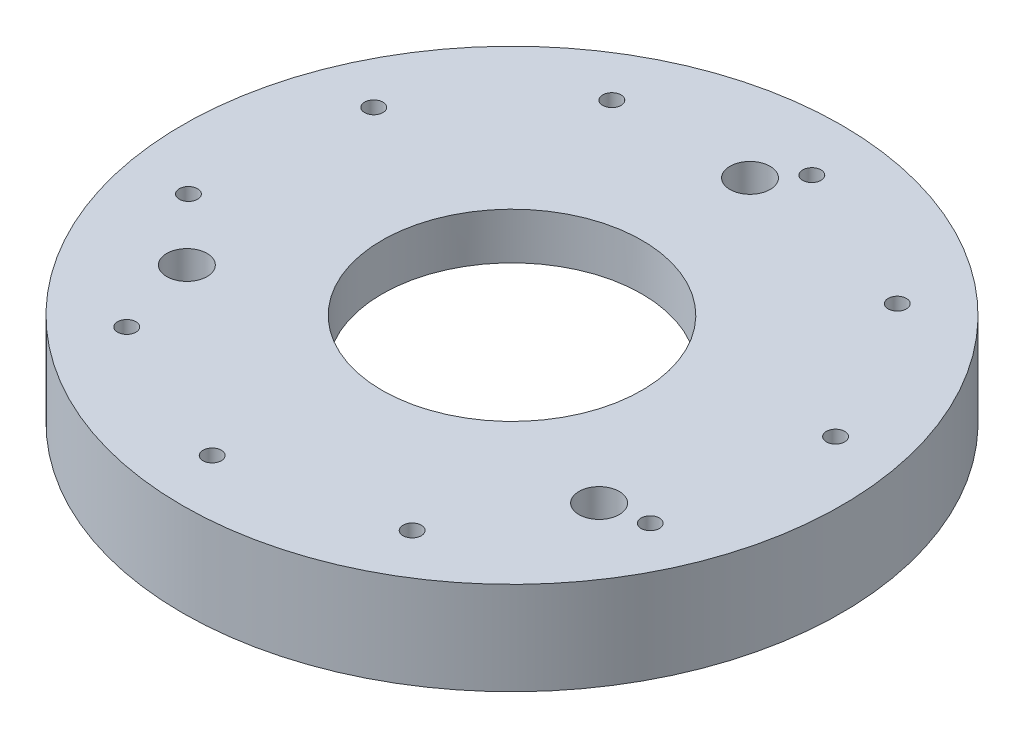
from build123d import *

# Parameters (mm, degrees)
SKETCH1_R           = 45
SKETCH1_R_2         = 2.75
SKETCH1_R_3         = 1.25
BOSS_EXTRUDE1_DEPTH = 12.7
SKETCH2_R           = 17.75
CUT_EXTRUDE1_DEPTH  = 6.35
SKETCH3_R           = 6
CUT_EXTRUDE2_DEPTH  = 64.95562915
SKETCH4_R           = 28.5
CUT_EXTRUDE3_DEPTH  = 6.35
SKETCH6_R           = 4.25
CUT_EXTRUDE4_DEPTH  = 6.35


with BuildPart() as part:
    # Sketch1 → Boss-Extrude1 (new body)
    with BuildSketch(Plane(origin=(0, 0, 0), x_dir=(1, 0, 0), z_dir=(0, 1, 0))):
        Circle(SKETCH1_R)
        with Locations((0, 32.5)):
            Circle(SKETCH1_R_2, mode=Mode.SUBTRACT)
        with Locations((28.145825623, -16.25)):
            Circle(SKETCH1_R_2, mode=Mode.SUBTRACT)
        with Locations((-28.145825623, -16.25)):
            Circle(SKETCH1_R_2, mode=Mode.SUBTRACT)
        with Locations((-36.435998127, -7.744710483)):
            Circle(SKETCH1_R_3, mode=Mode.SUBTRACT)
        with Locations((-34.029568297, 15.150939955)):
            Circle(SKETCH1_R_3, mode=Mode.SUBTRACT)
        with Locations((-18.625, 32.259446291)):
            Circle(SKETCH1_R_3, mode=Mode.SUBTRACT)
        with Locations((3.893685257, 37.045940602)):
            Circle(SKETCH1_R_3, mode=Mode.SUBTRACT)
        with Locations((24.925115087, 27.682144749)):
            Circle(SKETCH1_R_3, mode=Mode.SUBTRACT)
        with Locations((36.435998127, 7.744710483)):
            Circle(SKETCH1_R_3, mode=Mode.SUBTRACT)
        with Locations((34.029568297, -15.150939955)):
            Circle(SKETCH1_R_3, mode=Mode.SUBTRACT)
        with Locations((18.625, -32.259446291)):
            Circle(SKETCH1_R_3, mode=Mode.SUBTRACT)
        with Locations((-3.893685257, -37.045940602)):
            Circle(SKETCH1_R_3, mode=Mode.SUBTRACT)
        with Locations((-24.925115087, -27.682144749)):
            Circle(SKETCH1_R_3, mode=Mode.SUBTRACT)
    extrude(amount=BOSS_EXTRUDE1_DEPTH)

    # Sketch2 → Cut-Extrude1 (cut)
    with BuildSketch(Plane(origin=(0, 12.7, 0), x_dir=(1, 0, 0), z_dir=(0, 1, 0))):
        Circle(SKETCH2_R)
    extrude(amount=-CUT_EXTRUDE1_DEPTH, mode=Mode.SUBTRACT)

    # Sketch3 → Cut-Extrude2 (cut, through all)
    with BuildSketch(Plane(origin=(0, 6.35, 0), x_dir=(1, 0, 0), z_dir=(0, 1, 0))):
        Circle(SKETCH3_R)
    extrude(amount=-CUT_EXTRUDE2_DEPTH, mode=Mode.SUBTRACT)

    # Sketch4 → Cut-Extrude3 (cut)
    with BuildSketch(Plane.XZ):
        Circle(SKETCH4_R)
    extrude(amount=-CUT_EXTRUDE3_DEPTH, mode=Mode.SUBTRACT)

    # Sketch6 → Cut-Extrude4 (cut)
    with BuildSketch(Plane.XZ):
        with Locations((28.145825623, 16.25)):
            Circle(SKETCH6_R)
        with Locations((0, -32.5)):
            Circle(SKETCH6_R)
        with Locations((-28.145825623, 16.25)):
            Circle(SKETCH6_R)
    extrude(amount=-CUT_EXTRUDE4_DEPTH, mode=Mode.SUBTRACT)


solid = part.part
